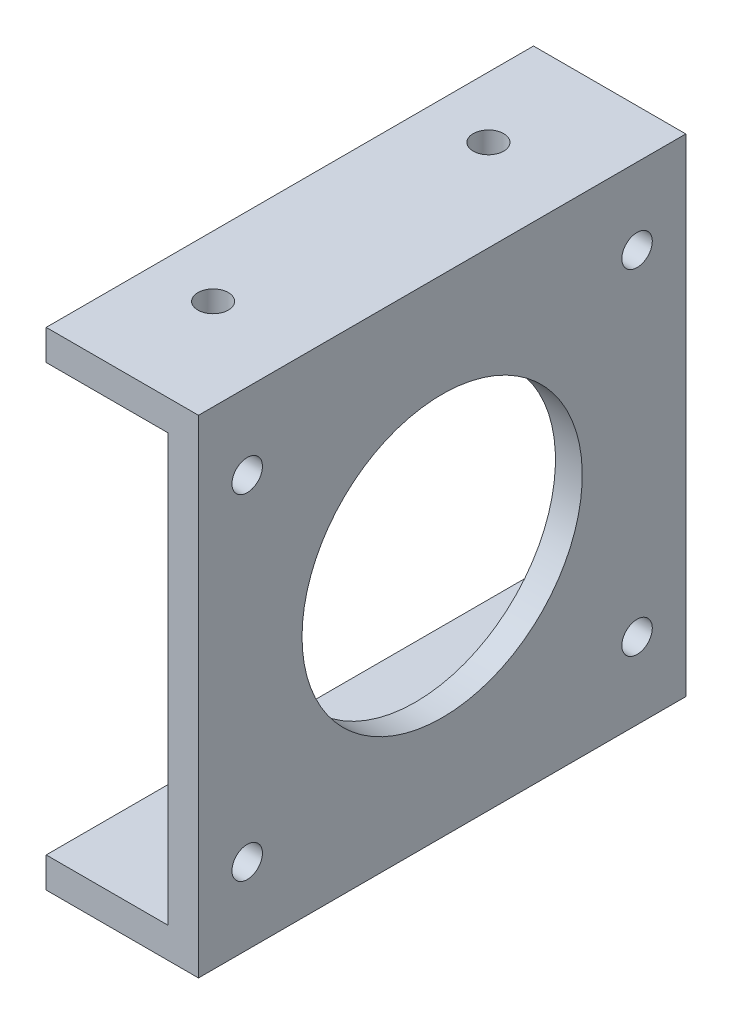
from build123d import *

# Parameters (mm, degrees)
BOSS_EXTRUDE1_DEPTH   = 80
SKETCH2_R             = 26
CUT_EXTRUDE1_DEPTH    = 0.6
FILLET1_R             = 0.6
SKETCH3_R             = 23
CUT_EXTRUDE2_DEPTH    = 4.4
M6X1_0_TAPPED_HOLE1_D = 5
M6X1_0_TAPPED_HOLE2_D = 5


with BuildPart() as part:
    # Sketch1 → Boss-Extrude1 (new body)
    with BuildSketch(Plane.XY):
        Polygon((0, 35), (20, 35), (20, -35), (0, -35), (0, -40), (25, -40), (25, 40), (0, 40), align=None)
    extrude(amount=BOSS_EXTRUDE1_DEPTH)

    # Sketch2 → Cut-Extrude1 (cut)
    with BuildSketch(Plane.ZY.offset(-20)):
        with Locations(Location((40, 0, 0), (0, 0, 270))):
            Circle(SKETCH2_R)
    extrude(amount=-CUT_EXTRUDE1_DEPTH, mode=Mode.SUBTRACT)

    # Fillet1
    fillet1_edges = [part.edges().sort_by_distance(p)[0] for p in [
        (20.6, 26, 40),
    ]]
    fillet(fillet1_edges, radius=FILLET1_R - 0.0001)  # a hair under: the kernel refuses the full size

    # Sketch3 → Cut-Extrude2 (cut)
    with BuildSketch(Plane.ZY.offset(-20.6)):
        with Locations(Location((40, 0, 0), (0, 0, 270))):
            Circle(SKETCH3_R)
    extrude(amount=-CUT_EXTRUDE2_DEPTH, mode=Mode.SUBTRACT)

    # M6x1.0 Tapped Hole1 (through all)
    with Locations(Plane(origin=(0, 40, 0), x_dir=(1, 0, 0), z_dir=(0, 1, 0))):
        with Locations((10, -17.4), (10, -62.6)):
            Hole(M6X1_0_TAPPED_HOLE1_D / 2)

    # M6x1.0 Tapped Hole2 (through all)
    with Locations(Plane(origin=(25, 0, 0), x_dir=(0, 0, -1), z_dir=(1, 0, 0))):
        with Locations((-72, 27.5), (-8, 27.5), (-8, -27.5), (-72, -27.5)):
            Hole(M6X1_0_TAPPED_HOLE2_D / 2)


solid = part.part
